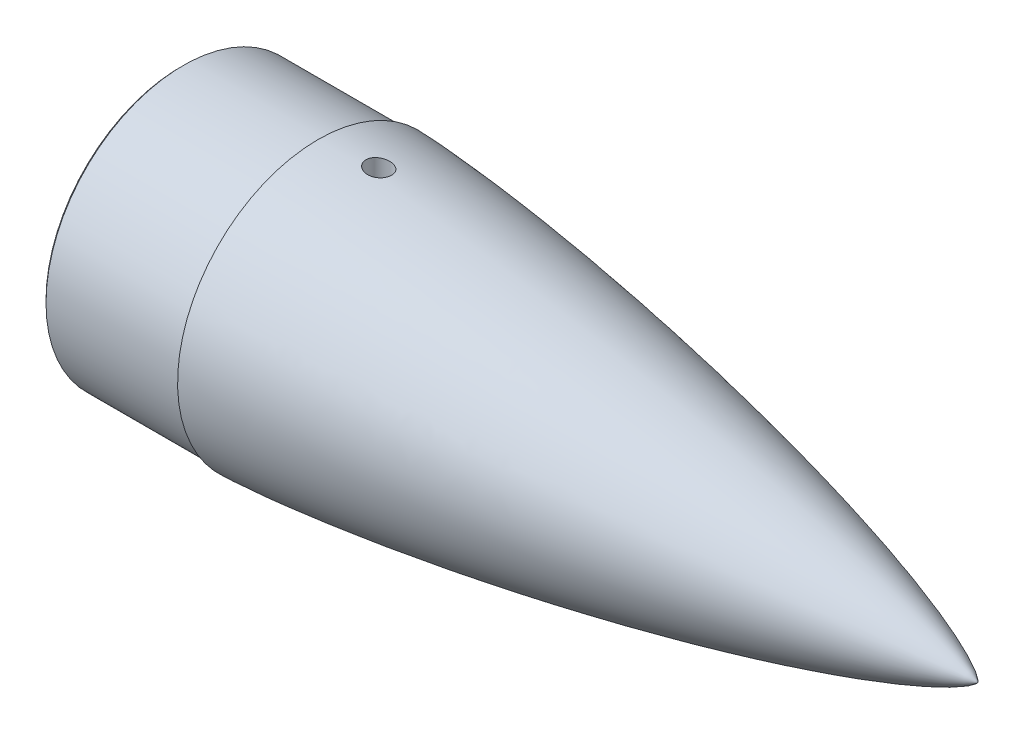
from build123d import *

# Parameters (mm, degrees)
CHAMFER1_SIZE      = 1.5
CIRPATTERN1_COUNT  = 6
SKETCH20_W         = 40
SKETCH20_H         = 40
CUT_EXTRUDE3_DEPTH = 12
SKETCH22_R         = 7.5
CUT_EXTRUDE4_DEPTH = 444.206648903


with BuildPart() as part:
    # Sketch10 → Revolve1 (revolve)
    with BuildSketch(Plane.XY):
        with BuildLine():
            Line((11.112493743, 81.99983), (11.112493743, 67.49983))
            Line((11.112493743, 67.49983), (129.304508698, 67.49983))
            add(Edge.make_bspline(
                [(368.967251823, 0), (368.965299543, 0.012338489), (368.959416882, 0.036518378), (368.940636147, 0.082964007), (368.902304552, 0.158736421), (368.845538097, 0.250270687), (368.755690124, 0.376555746), (368.616653262, 0.54835284), (368.392888737, 0.793577299), (368.008659121, 1.164904965), (367.344738263, 1.729853685), (366.176060796, 2.601559154), (364.09282389, 3.960032328), (360.425978756, 6.040734396), (354.402196649, 9.01831007), (344.042994901, 13.507695011), (329.152005398, 19.128483965), (310.425167902, 25.398569259), (288.741266406, 31.933693508), (266.378532845, 38.106125474), (243.901379123, 43.846895186), (221.331994001, 49.212017941), (198.683967629, 54.234500927), (175.966897581, 58.934255644), (156.034567874, 62.771715365), (141.509051931, 65.395628269), (132.679425236, 66.924517444), (129.562757302, 67.455859883), (129.304508698, 67.49983)],
                knots=[0, 0, 0, 0, 0, 0.000134949, 0.000269899, 0.000539798, 0.000919537, 0.001299277, 0.001947431, 0.00293136, 0.004511869, 0.007081312, 0.011380263, 0.018707867, 0.031423867, 0.052705479, 0.084103008, 0.140910136, 0.203703492, 0.266497064, 0.329290816, 0.392084375, 0.454877964, 0.517671564, 0.580465191, 0.643258828, 0.674655593, 0.677492072, 0.677492072, 0.677492072, 0.677492072, 0.677492072], degree=4))
            Line((368.967251823, 0), (408.967251823, 0))
            add(Edge.make_bspline(
                [(408.967251823, 0), (408.964913524, 0.013501739), (408.958040758, 0.039916077), (408.936520441, 0.090485698), (408.892222076, 0.174057132), (408.826281575, 0.275556803), (408.721696416, 0.415833756), (408.561101809, 0.605075245), (408.30561918, 0.87242415), (407.86966713, 1.275299562), (407.120955138, 1.885142115), (405.803773451, 2.82590185), (403.46240692, 4.287152794), (399.325294488, 6.531818454), (392.481146888, 9.758904649), (380.662076725, 14.628008466), (363.637187185, 20.711720382), (342.215241093, 27.476512989), (317.428462321, 34.49762647), (291.879335737, 41.10482439), (266.21046092, 47.228993169), (240.44548836, 52.933436777), (214.598861982, 58.255439009), (188.68089566, 63.217582693), (165.946174917, 67.253280679), (146.421982586, 70.493799722), (130.127893898, 73.044947468), (117.078590637, 74.994157933), (104.015464216, 76.84854079), (92.573263959, 78.384492045), (82.757139441, 79.635603973), (74.571340184, 80.632219902), (68.019260454, 81.400804211), (61.463723364, 82.139375899), (54.90469802, 82.84637726), (48.342159918, 83.519940506), (41.776057559, 84.15778717), (36.02754108, 84.682157239), (31.097921259, 85.105234912), (26.988317923, 85.438669825), (23.699666618, 85.693218594), (20.085807822, 85.958448038), (16.719873821, 86.189018485), (13.602098287, 86.386966779), (10.732704013, 86.554575744), (8.436635008, 86.678703291), (6.139997341, 86.792157585), (4.129892063, 86.879313264), (2.40653858, 86.944618982), (1.257348635, 86.979022496), (0.68269791, 86.99491462), (0.395312527, 86.99983)],
                knots=[0, 0, 0, 0, 0, 0.000130123, 0.000260245, 0.000520491, 0.000900391, 0.00128029, 0.001925099, 0.002881508, 0.004418208, 0.006927086, 0.011110697, 0.018279138, 0.03067276, 0.051704469, 0.08310228, 0.139908797, 0.202702513, 0.265496165, 0.328289682, 0.391083359, 0.453876973, 0.516670577, 0.579464197, 0.642257765, 0.673654596, 0.705051427, 0.736448267, 0.767845106, 0.799241874, 0.814940257, 0.830638641, 0.846337073, 0.862035505, 0.877733936, 0.893432368, 0.90913072, 0.924829072, 0.932678248, 0.940527424, 0.9483766, 0.956225776, 0.967169332, 0.97264111, 0.978112888, 0.983584666, 0.989056444, 0.994528222, 0.997264111, 1, 1, 1, 1, 1], degree=4))
            Line((0.395312527, 86.99983), (0.395312527, 84.99983))
            Line((0.395312527, 84.99983), (-84.604517473, 84.99983))
            Line((-84.604517473, 84.99983), (-84.604517473, 81.99983))
            Line((-84.604517473, 81.99983), (11.112493743, 81.99983))
        make_face()
    revolve(axis=Axis((46.917858469, 0, 0), (-1, 0, 0)))

    # Chamfer1
    chamfer1_edges = [part.edges().sort_by_distance(p)[0] for p in [
        (-84.604517473, -84.99983, 0),
    ]]
    chamfer(chamfer1_edges, length=CHAMFER1_SIZE)

    # Sketch18 → Tapped Hole for M4x0.7 Helicoil1 (revolve, cut)
    with BuildSketch(Plane(origin=(11.112493743, 64.735251709, -37.374915), x_dir=(0, 0, 1), z_dir=(0, 1, 0))):
        Polygon((0, 0), (0, 31.2618073), (2.1, 30), (2.1, 0), align=None)
    tapped_hole_for_m4x0_7_helicoil1 = revolve(axis=Axis((4.762493743, 64.735251709, -37.374915), (1, 0, 0)), mode=Mode.SUBTRACT)

    # CirPattern1: Tapped Hole for M4x0.7 Helicoil1 ×6 about axis
    cirpattern1_axis = Axis((11.112493743, 0, 0), (1, 0, 0))
    for i in range(1, CIRPATTERN1_COUNT):
        add(tapped_hole_for_m4x0_7_helicoil1.rotate(cirpattern1_axis, i * 360 / CIRPATTERN1_COUNT), mode=Mode.SUBTRACT)

    # Sketch20 → Cut-Extrude3 (cut)
    with BuildSketch(Plane(origin=(0, 60, 0), x_dir=(1, 0, 0), z_dir=(0, 1, 0))):
        with Locations((44.770184194, 5)):
            Rectangle(SKETCH20_W, SKETCH20_H)
    extrude(amount=CUT_EXTRUDE3_DEPTH, mode=Mode.SUBTRACT)

    # Sketch22 → Cut-Extrude4 (cut, through all)
    with BuildSketch(Plane(origin=(0, 60, 0), x_dir=(1, 0, 0), z_dir=(0, 1, 0))):
        with Locations((32, 6)):
            Circle(SKETCH22_R)
    extrude(amount=CUT_EXTRUDE4_DEPTH, mode=Mode.SUBTRACT)


solid = part.part
